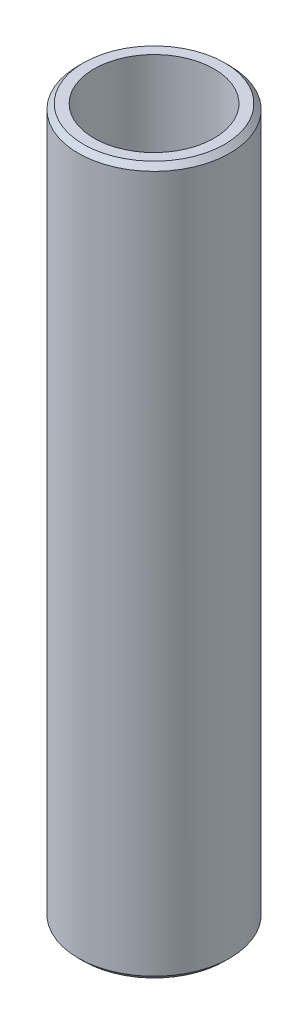
from build123d import *

# Parameters (mm, degrees)
SKETCH1_R           = 52.5
BOSS_EXTRUDE1_DEPTH = 490.024110291
SKETCH2_R           = 41.61037376
CUT_EXTRUDE1_DEPTH  = 496.616917252
CHAMFER1_SIZE       = 3.579889185


with BuildPart() as part:
    # Sketch1 → Boss-Extrude1 (new body)
    with BuildSketch(Plane(origin=(0, 0, 0), x_dir=(1, 0, 0), z_dir=(0, 1, 0))):
        Circle(SKETCH1_R)
    extrude(amount=BOSS_EXTRUDE1_DEPTH)

    # Sketch2 → Cut-Extrude1 (cut, through all)
    with BuildSketch(Plane(origin=(0, 0, 0), x_dir=(1, 0, 0), z_dir=(0, 1, 0))):
        Circle(SKETCH2_R)
    extrude(amount=CUT_EXTRUDE1_DEPTH, mode=Mode.SUBTRACT)

    # Chamfer1
    chamfer1_edges = [part.edges().sort_by_distance(p)[0] for p in [
        (-52.5, 490.024110291, 0),
        (-52.5, 0, 0),
    ]]
    chamfer(chamfer1_edges, length=CHAMFER1_SIZE)


solid = part.part
